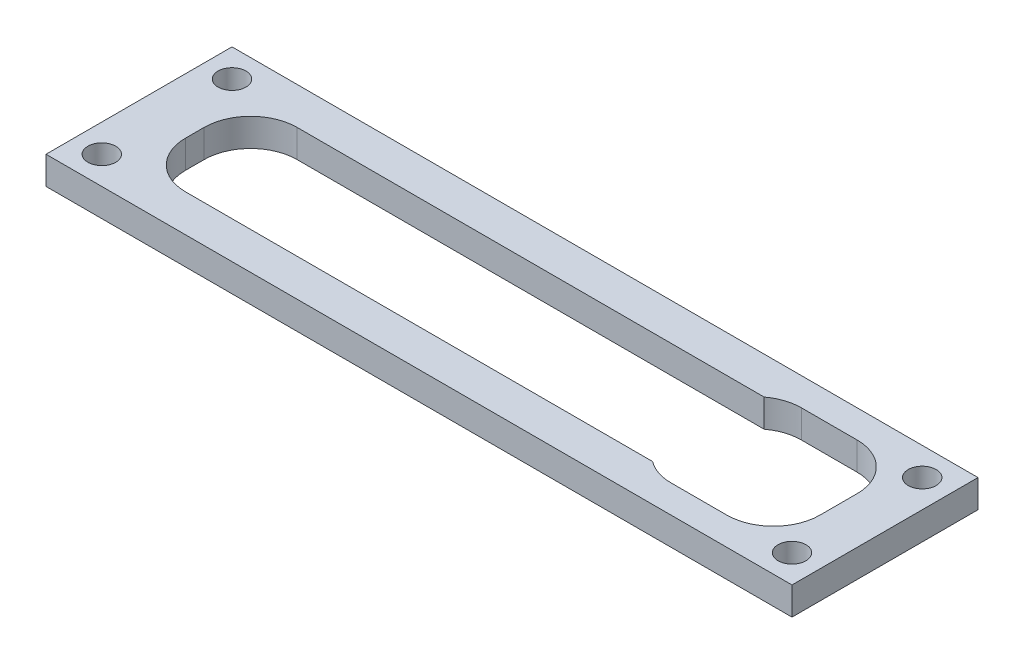
from build123d import *

# Parameters (mm, degrees)
SKETCH1_W           = 80.213910902
SKETCH1_H           = 20
SKETCH1_R           = 1.5
SKETCH1_W_2         = 68.213910902
SKETCH1_H_2         = 12
BOSS_EXTRUDE1_DEPTH = 3
CUT_EXTRUDE1_DEPTH  = 83.724068458
FILLET1_R           = 5


with BuildPart() as part:
    # Sketch1 → Boss-Extrude1 (new body)
    with BuildSketch(Plane(origin=(0, 0, 0), x_dir=(1, 0, 0), z_dir=(0, 1, 0))):
        with Locations((40.106955451, 10)):
            Rectangle(SKETCH1_W, SKETCH1_H)
        with Locations(Location((3, 17, 0), (0, 0, 270))):
            Circle(SKETCH1_R, mode=Mode.SUBTRACT)
        with Locations(Location((3, 3, 0), (0, 0, 90))):
            Circle(SKETCH1_R, mode=Mode.SUBTRACT)
        with Locations(Location((77.213910902, 3, 0), (0, 0, 270))):
            Circle(SKETCH1_R, mode=Mode.SUBTRACT)
        with Locations(Location((77.213910902, 17, 0), (0, 0, 90))):
            Circle(SKETCH1_R, mode=Mode.SUBTRACT)
        with Locations((40.106955451, 10)):
            Rectangle(SKETCH1_W_2, SKETCH1_H_2, mode=Mode.SUBTRACT)
    extrude(amount=BOSS_EXTRUDE1_DEPTH)

    # Sketch2 → Cut-Extrude1 (cut, through all)
    with BuildSketch(Plane(origin=(0, 3, 0), x_dir=(1, 0, 0), z_dir=(0, 1, 0))):
        Polygon((61.213910902, 17), (61.213910902, 16), (74.213910902, 16), (74.213910902, 4), (61.213910902, 4), (61.213910902, 3), (75.213910902, 3), (75.213910902, 17), align=None)
    extrude(amount=-CUT_EXTRUDE1_DEPTH, mode=Mode.SUBTRACT)

    # Fillet1
    # the kernel refuses this fillet: 5 mm, written as the material it adds along each edge
    with BuildSketch(Plane(origin=(75.213910902, 3, -17), x_dir=(0, 0, 1), z_dir=(0, -1, 0)), Plane(origin=(75.213910902, 3, -3), x_dir=(-1, 0, 0), z_dir=(0, -1, 0)), Plane(origin=(6, 0, -16), x_dir=(0, 0, 1), z_dir=(0, 1, 0))) as fillet1_piece_1:
        with BuildLine():
            CenterArc((FILLET1_R, FILLET1_R), FILLET1_R, 180, 90)
            Line((0, FILLET1_R), (-FILLET1_R * 0.02, FILLET1_R))
            Line((-FILLET1_R * 0.02, FILLET1_R), (-FILLET1_R * 0.02, -FILLET1_R * 0.02))
            Line((-FILLET1_R * 0.02, -FILLET1_R * 0.02), (FILLET1_R, -FILLET1_R * 0.02))
            Line((FILLET1_R, -FILLET1_R * 0.02), (FILLET1_R, 0))
        make_face()
    extrude(amount=3)
    with BuildSketch(Plane(origin=(61.213910902, 3, -17), x_dir=(1, 0, 0), z_dir=(0, -1, 0))) as fillet1_piece_2:
        with BuildLine():
            CenterArc((3, 5), FILLET1_R, 233.130102354, 36.869897646)
            Line((0, 1), (-0.06, 0.92))
            ThreePointArc((-0.06, 0.92), (-0.1, 0.5), (-0.1, 0))
            Line((-0.1, 0), (0, -0.1))
            Line((0, -0.1), (3, -0.1))
            Line((3, -0.1), (3, 0))
        make_face()
    extrude(amount=3)
    with BuildSketch(Plane(origin=(61.213910902, 3, -3), x_dir=(0, 0, -1), z_dir=(0, -1, 0))) as fillet1_piece_3:
        with BuildLine():
            CenterArc((5, 3), FILLET1_R, 180, 36.869897646)
            Line((0, 3), (-0.1, 3))
            Line((-0.1, 3), (-0.1, 0))
            Line((-0.1, 0), (0, -0.1))
            ThreePointArc((0, -0.1), (0.5, -0.1), (0.92, -0.06))
            Line((0.92, -0.06), (1, 0))
        make_face()
    extrude(amount=3)
    with BuildSketch(Plane(origin=(6, 0, -4), x_dir=(0, 0, -1), z_dir=(0, 1, 0))) as fillet1_piece_4:
        with BuildLine():
            CenterArc((FILLET1_R, -FILLET1_R), FILLET1_R, 90, 90)
            Line((0, -FILLET1_R), (-FILLET1_R * 0.02, -FILLET1_R))
            Line((-FILLET1_R * 0.02, -FILLET1_R), (-FILLET1_R * 0.02, FILLET1_R * 0.02))
            Line((-FILLET1_R * 0.02, FILLET1_R * 0.02), (FILLET1_R, FILLET1_R * 0.02))
            Line((FILLET1_R, FILLET1_R * 0.02), (FILLET1_R, 0))
        make_face()
    extrude(amount=3)


solid = part.part
